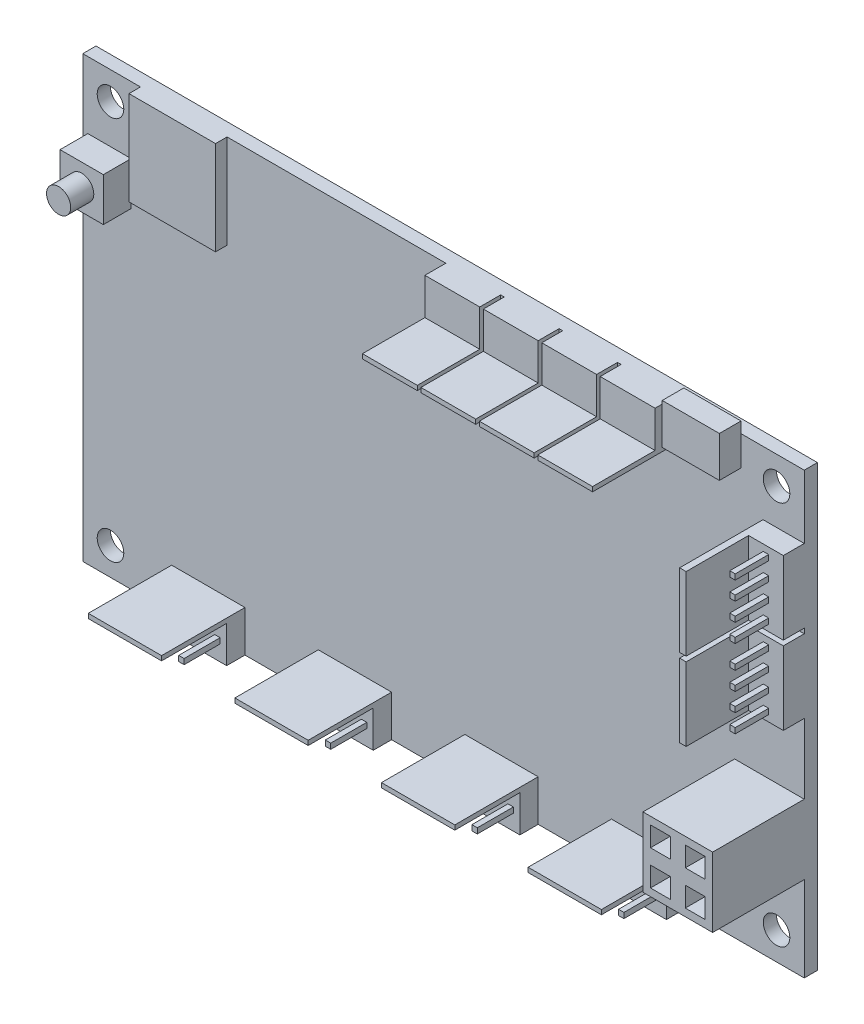
from build123d import *

# Parameters (mm, degrees)
SKETCH1_W             = 100
SKETCH1_H             = 60.96
BOSS_EXTRUDE1_DEPTH   = 1.8288
SKETCH2_W             = 10.16
SKETCH2_H             = 5.715
SKETCH2_W_2           = 5.715
SKETCH2_H_2           = 10.16
F_4_PIN_MOLEX_DEPTH   = 11.557
SKETCH3_W             = 9.017
SKETCH3_H             = 5.08
CUT_EXTRUDE1_DEPTH    = 105.19869463
SKETCH7_W             = 4.815
SKETCH7_H             = 8.657
CUT_EXTRUDE2_DEPTH    = 24.6
SKETCH4_W             = 9.652
SKETCH4_H             = 9.652
POWER_CONNECTOR_DEPTH = 12.7
SKETCH5_W             = 7.9248
SKETCH5_H             = 5.6388
MICROUSB_DEPTH        = 3
SKETCH6_W             = 12
SKETCH6_H             = 13
MICROSD_DEPTH         = 1.6
SKETCH8_W             = 6
SKETCH8_H             = 6
BOSS_EXTRUDE6_DEPTH   = 3.85
SKETCH9_R             = 1.675
BOSS_EXTRUDE7_DEPTH   = 3.2
SKETCH10_W            = 7.6
SKETCH10_H            = 5.715
BOSS_EXTRUDE8_DEPTH   = 11.557
SKETCH11_W            = 8.657
SKETCH11_H            = 5.08
CUT_EXTRUDE3_DEPTH    = 36.449
SKETCH13_R            = 1.8415
CUT_EXTRUDE4_DEPTH    = 36.449
SKETCH14_W            = 2.75
SKETCH14_H            = 2.75
CUT_EXTRUDE5_DEPTH    = 5
SKETCH15_W            = 0.75
SKETCH15_H            = 0.75
BOSS_EXTRUDE9_DEPTH   = 5


with BuildPart() as part:
    # Sketch1 → Boss-Extrude1 (new body)
    with BuildSketch(Plane.XY):
        with Locations((50, 30.48)):
            Rectangle(SKETCH1_W, SKETCH1_H)
    extrude(amount=BOSS_EXTRUDE1_DEPTH)

    # Sketch2 → 4 pin molex (add)
    with BuildSketch(Plane.XY.offset(1.8288)):
        with Locations((17.399, 2.8575)):
            Rectangle(SKETCH2_W, SKETCH2_H)
        with Locations((37.719, 2.8575)):
            Rectangle(SKETCH2_W, SKETCH2_H)
        with Locations((58.039, 2.8575)):
            Rectangle(SKETCH2_W, SKETCH2_H)
        with Locations((78.359, 2.8575)):
            Rectangle(SKETCH2_W, SKETCH2_H)
        with Locations((97.1425, 47.08)):
            Rectangle(SKETCH2_W_2, SKETCH2_H_2)
        with Locations((97.1425, 36.24)):
            Rectangle(SKETCH2_W_2, SKETCH2_H_2)
    extrude(amount=F_4_PIN_MOLEX_DEPTH)

    # Sketch3 → Cut-Extrude1 (cut, through all)
    with BuildSketch(Plane(origin=(83.439, 0, 0), x_dir=(0, 0, -1), z_dir=(1, 0, 0))):
        with Locations((-8.8773, 2.54)):
            Rectangle(SKETCH3_W, SKETCH3_H)
    extrude(amount=-CUT_EXTRUDE1_DEPTH, mode=Mode.SUBTRACT)

    # Sketch7 → Cut-Extrude2 (cut)
    with BuildSketch(Plane(origin=(0, 31.16, 0), x_dir=(-1, 0, 0), z_dir=(0, -1, 0))):
        with Locations((-97.5925, -9.0573)):
            Rectangle(SKETCH7_W, SKETCH7_H)
    extrude(amount=-CUT_EXTRUDE2_DEPTH, mode=Mode.SUBTRACT)

    # Sketch4 → Power Connector (add)
    with BuildSketch(Plane.XY.offset(1.8288)):
        with Locations((95.174, 16.637)):
            Rectangle(SKETCH4_W, SKETCH4_H)
    extrude(amount=POWER_CONNECTOR_DEPTH)

    # Sketch5 → MicroUSB (add)
    with BuildSketch(Plane.XY.offset(1.8288)):
        with Locations((87.2746, 59.6646)):
            Rectangle(SKETCH5_W, SKETCH5_H)
    extrude(amount=MICROUSB_DEPTH)

    # Sketch6 → MicroSD (add)
    with BuildSketch(Plane.XY.offset(1.8288)):
        with Locations((14, 54.46)):
            Rectangle(SKETCH6_W, SKETCH6_H)
    extrude(amount=MICROSD_DEPTH)

    # Sketch8 → Boss-Extrude6 (add)
    with BuildSketch(Plane.XY.offset(1.8288)):
        with Locations((3.7, 48.71)):
            Rectangle(SKETCH8_W, SKETCH8_H)
    extrude(amount=BOSS_EXTRUDE6_DEPTH)

    # Sketch9 → Boss-Extrude7 (add)
    with BuildSketch(Plane.XY.offset(5.6788)):
        with Locations((3.7, 48.71)):
            Circle(SKETCH9_R)
    extrude(amount=BOSS_EXTRUDE7_DEPTH)

    # Sketch10 → Boss-Extrude8 (add)
    with BuildSketch(Plane.XY.offset(1.8288)):
        with Locations((78.42, 58.1025)):
            Rectangle(SKETCH10_W, SKETCH10_H)
        with Locations((70.32, 58.1025)):
            Rectangle(SKETCH10_W, SKETCH10_H)
        with Locations((62.22, 58.1025)):
            Rectangle(SKETCH10_W, SKETCH10_H)
        with Locations((54.12, 58.1025)):
            Rectangle(SKETCH10_W, SKETCH10_H)
    extrude(amount=BOSS_EXTRUDE8_DEPTH)

    # Sketch11 → Cut-Extrude3 (cut)
    with BuildSketch(Plane(origin=(82.22, 0, 0), x_dir=(0, 0, -1), z_dir=(1, 0, 0))):
        with Locations((-9.0573, 58.42)):
            Rectangle(SKETCH11_W, SKETCH11_H)
    extrude(amount=-CUT_EXTRUDE3_DEPTH, mode=Mode.SUBTRACT)

    # Sketch13 → Cut-Extrude4 (cut)
    with BuildSketch(Plane.XY.offset(1.8288)):
        with Locations((3.841500064, 57.1185)):
            Circle(SKETCH13_R)
        with Locations((3.841500064, 3.8415)):
            Circle(SKETCH13_R)
        with Locations((96.1585, 3.8415)):
            Circle(SKETCH13_R)
        with Locations((96.1585, 57.1185)):
            Circle(SKETCH13_R)
    extrude(amount=-CUT_EXTRUDE4_DEPTH, mode=Mode.SUBTRACT)

    # Sketch14 → Cut-Extrude5 (cut)
    with BuildSketch(Plane.XY.offset(14.5288)):
        with Locations((92.761, 19.05)):
            Rectangle(SKETCH14_W, SKETCH14_H)
        with Locations((97.587, 19.05)):
            Rectangle(SKETCH14_W, SKETCH14_H)
        with Locations((97.587, 14.224)):
            Rectangle(SKETCH14_W, SKETCH14_H)
        with Locations((92.761, 14.224)):
            Rectangle(SKETCH14_W, SKETCH14_H)
    extrude(amount=-CUT_EXTRUDE5_DEPTH, mode=Mode.SUBTRACT)

    # Sketch15 → Boss-Extrude9 (add)
    with BuildSketch(Plane.XY.offset(4.3688)):
        with Locations((56.769, 2.54)):
            Rectangle(SKETCH15_W, SKETCH15_H)
        with Locations((54.229, 2.54)):
            Rectangle(SKETCH15_W, SKETCH15_H)
        with Locations((59.309, 2.54)):
            Rectangle(SKETCH15_W, SKETCH15_H)
        with Locations((61.849, 2.54)):
            Rectangle(SKETCH15_W, SKETCH15_H)
        with Locations((97.5925, 34.97)):
            Rectangle(SKETCH15_W, SKETCH15_H)
        with Locations((97.5925, 32.43)):
            Rectangle(SKETCH15_W, SKETCH15_H)
        with Locations((97.5925, 37.51)):
            Rectangle(SKETCH15_W, SKETCH15_H)
        with Locations((97.5925, 40.05)):
            Rectangle(SKETCH15_W, SKETCH15_H)
        with Locations((97.5925, 45.81)):
            Rectangle(SKETCH15_W, SKETCH15_H)
        with Locations((97.5925, 43.27)):
            Rectangle(SKETCH15_W, SKETCH15_H)
        with Locations((97.5925, 48.35)):
            Rectangle(SKETCH15_W, SKETCH15_H)
        with Locations((97.5925, 50.89)):
            Rectangle(SKETCH15_W, SKETCH15_H)
        with Locations((16.129, 2.54)):
            Rectangle(SKETCH15_W, SKETCH15_H)
        with Locations((13.589, 2.54)):
            Rectangle(SKETCH15_W, SKETCH15_H)
        with Locations((18.669, 2.54)):
            Rectangle(SKETCH15_W, SKETCH15_H)
        with Locations((21.209, 2.54)):
            Rectangle(SKETCH15_W, SKETCH15_H)
        with Locations((36.449, 2.54)):
            Rectangle(SKETCH15_W, SKETCH15_H)
        with Locations((33.909, 2.54)):
            Rectangle(SKETCH15_W, SKETCH15_H)
        with Locations((38.989, 2.54)):
            Rectangle(SKETCH15_W, SKETCH15_H)
        with Locations((41.529, 2.54)):
            Rectangle(SKETCH15_W, SKETCH15_H)
        with Locations((77.089, 2.54)):
            Rectangle(SKETCH15_W, SKETCH15_H)
        with Locations((74.549, 2.54)):
            Rectangle(SKETCH15_W, SKETCH15_H)
        with Locations((79.629, 2.54)):
            Rectangle(SKETCH15_W, SKETCH15_H)
        with Locations((82.169, 2.54)):
            Rectangle(SKETCH15_W, SKETCH15_H)
    extrude(amount=BOSS_EXTRUDE9_DEPTH)


solid = part.part
